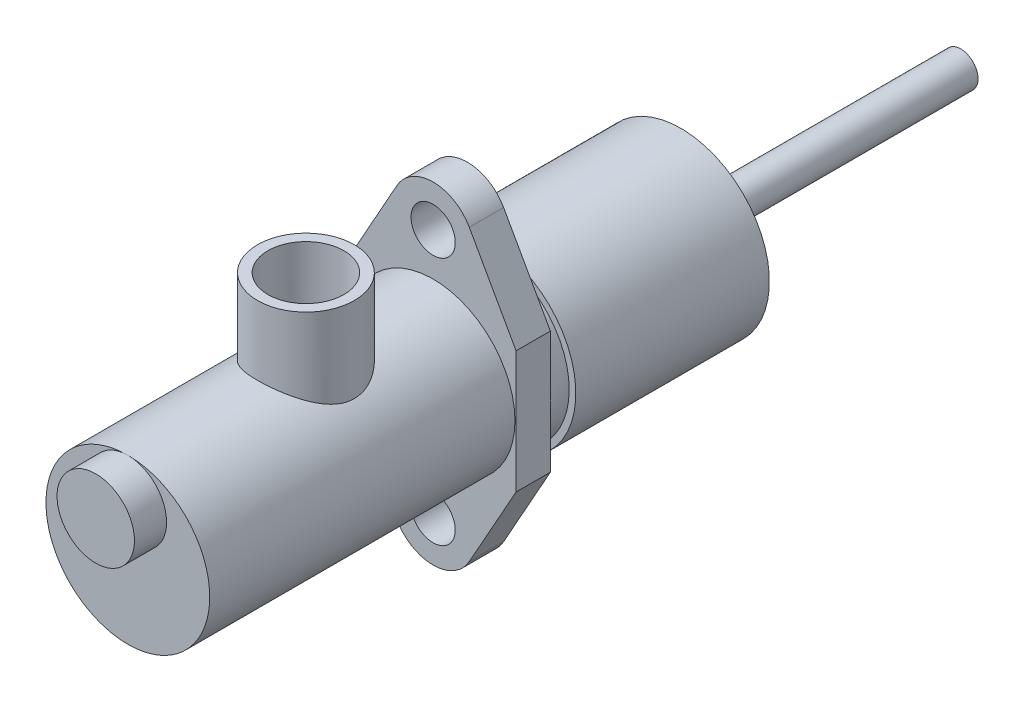
from build123d import *

# Parameters (mm, degrees)
MASTER_CYLINDER_BODY_DEPTH             = 77.978
MASTER_CYLINDER_BODY_DEPTH_BACK        = 4.572
SKETCH1_R                              = 18.796
MASTER_START                           = -7.874
MASTER_CYLINDER_MOUNTS_OUTLINE_R       = 5.08
MASTER_CYLINDER_MOUNTS_OUTLINE_R_2     = 18.796
MASTER_CYLINDER_MOUNTS_DEPTH           = 7.874
SKETCH3_R                              = 11.1125
SKETCH3_R_2                            = 8.73125
RESERVOIR_MOUNT_DEPTH                  = 15.875
RESERVOIR_MOUNT_DIRECTION_2_REACH      = 100.39
RESERVOIR_MOUNT_DIRECTION_2_END_RADIUS = 18.796
SKETCH5_R                              = 8.89
MASTER_CYLINDER_OUTLET_DEPTH           = 7.366
SKETCH6_R                              = 3.96875
PUSHROD_DEPTH                          = 108.712
SKETCH7_R                              = 20.32
RUBBER_COVER_DEPTH                     = 44.45


# Read off the part's stored shape, not the designer's step: Master Cylinder Mounts
with BuildPart() as part:
    # Sketch1 → Master Cylinder Body (new, two sides: drawn at the far end of the back side and taken through both)
    with BuildSketch(Plane.XY.offset(-MASTER_CYLINDER_BODY_DEPTH_BACK)):
        Circle(SKETCH1_R)
    extrude(amount=MASTER_CYLINDER_BODY_DEPTH + MASTER_CYLINDER_BODY_DEPTH_BACK)

    # Master Cylinder Mounts outline → Master Cylinder Mounts (add)
    with BuildSketch(Plane(origin=(0, 0, 0), x_dir=(-1, 0, 0), z_dir=(0, 0, -1)).offset(MASTER_START)):
        with BuildLine():
            ThreePointArc((-8.312226974, -33.226075976), (0, -38.1), (8.312226974, -33.226075976))
            Line((8.312226974, -33.226075976), (19.05, -14.035934373))
            Line((19.05, -14.035934373), (19.05, 14.035934373))
            Line((19.05, 14.035934373), (8.312226974, 33.226075976))
            ThreePointArc((8.312226974, 33.226075976), (0, 38.1), (-8.312226974, 33.226075976))
            Line((-8.312226974, 33.226075976), (-19.05, 14.035934373))
            Line((-19.05, 14.035934373), (-19.05, -14.035934373))
            Line((-19.05, -14.035934373), (-8.312226974, -33.226075976))
        make_face()
        with Locations((0, -28.575)):
            Circle(MASTER_CYLINDER_MOUNTS_OUTLINE_R, mode=Mode.SUBTRACT)
        Circle(MASTER_CYLINDER_MOUNTS_OUTLINE_R_2, mode=Mode.SUBTRACT)
        with Locations((0, 28.575)):
            Circle(MASTER_CYLINDER_MOUNTS_OUTLINE_R, mode=Mode.SUBTRACT)
    extrude(amount=MASTER_CYLINDER_MOUNTS_DEPTH)

    # Sketch3 → Reservoir Mount (add)
    with BuildSketch(Plane(origin=(0, 18.796, 0), x_dir=(1, 0, 0), z_dir=(0, 1, 0))):
        with Locations(Location((0, -37.084, 0), (0, 0, 270))):
            Circle(SKETCH3_R)
        with Locations(Location((0, -37.084, 0), (0, 0, 90))):
            Circle(SKETCH3_R_2, mode=Mode.SUBTRACT)
    extrude(amount=RESERVOIR_MOUNT_DEPTH)

    # Reservoir Mount direction 2: up to this cylinder (the profile starts outside it)
    reservoir_mount_direction_2_end = Plane(origin=(0, 0, 26.285809), z_dir=(0, 0, 1)) * Cylinder(RESERVOIR_MOUNT_DIRECTION_2_END_RADIUS, 239.372, mode=Mode.PRIVATE)
    # Sketch3 → Reservoir Mount direction 2 (add, up to the surface)
    with BuildSketch(Plane(origin=(0, 18.796, 0), x_dir=(1, 0, 0), z_dir=(0, 1, 0)), mode=Mode.PRIVATE) as reservoir_mount_direction_2_sk1:
        with Locations(Location((0, -37.084, 0), (0, 0, 270))):
            Circle(SKETCH3_R)
        with Locations(Location((0, -37.084, 0), (0, 0, 90))):
            Circle(SKETCH3_R_2, mode=Mode.SUBTRACT)
    reservoir_mount_direction_2_tool1 = extrude(reservoir_mount_direction_2_sk1.sketch, amount=-RESERVOIR_MOUNT_DIRECTION_2_REACH, mode=Mode.PRIVATE) - reservoir_mount_direction_2_end
    add(reservoir_mount_direction_2_tool1.solids().sort_by_distance((0, 18.796, 26.285809))[0])
    add(reservoir_mount_direction_2_tool1.solids().sort_by_distance((0, 18.796, 26.285809))[1])

    # Sketch5 → Master Cylinder Outlet (add)
    with BuildSketch(Plane.XY.offset(77.978)):
        with Locations(Location((0, 9.906, 0), (0, 0, 90))):
            Circle(SKETCH5_R)
    extrude(amount=MASTER_CYLINDER_OUTLET_DEPTH)

    # Sketch6 → Pushrod (add)
    with BuildSketch(Plane(origin=(0, 0, -4.572), x_dir=(-1, 0, 0), z_dir=(0, 0, -1))):
        with Locations(Location((0, 0, 0), (0, 0, 180))):
            Circle(SKETCH6_R)
    extrude(amount=PUSHROD_DEPTH)

    # Sketch7 → Rubber Cover (add)
    with BuildSketch(Plane(origin=(0, 0, -4.572), x_dir=(-1, 0, 0), z_dir=(0, 0, -1))):
        Circle(SKETCH7_R)
    extrude(amount=RUBBER_COVER_DEPTH)


solid = part.part
